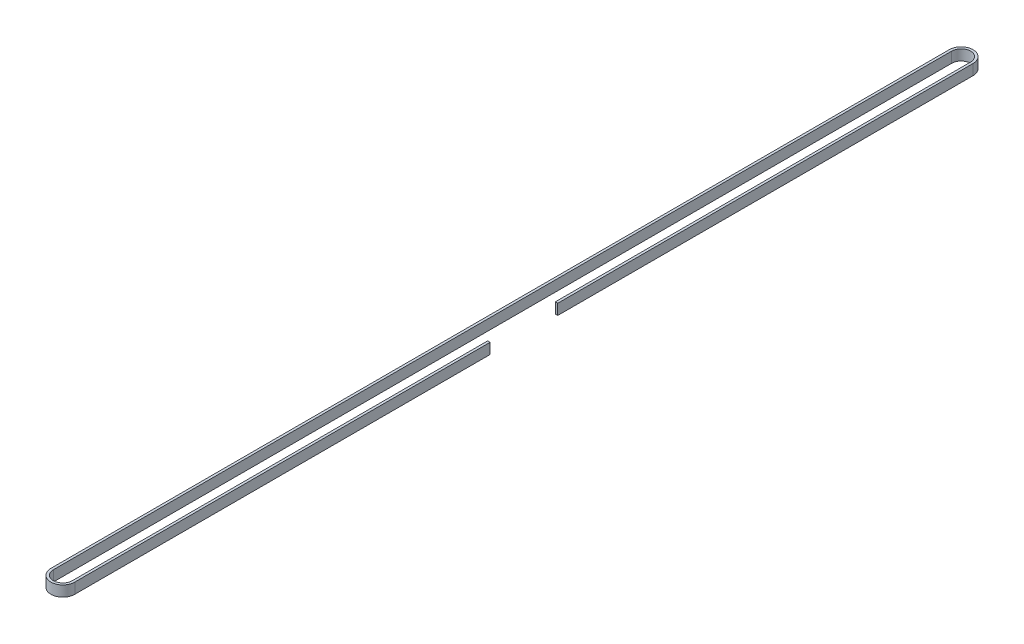
from build123d import *

# Parameters (mm, degrees)
EXTRUDE_THIN1_DEPTH = 6


with BuildPart() as part:
    # Sketch1 → Extrude-Thin1 (new body)
    with BuildSketch(Plane(origin=(0, 0, 0), x_dir=(1, 0, 0), z_dir=(0, 1, 0))):
        with BuildLine():
            Line((355.746, -59.767481844), (355.746, -294.767481844))
            ThreePointArc((355.746, -294.767481844), (350.38, -300.133481844), (345.014, -294.767481844))
            Line((345.014, -294.767481844), (345.014, 213.482518156))
            ThreePointArc((345.014, 213.482518156), (350.38, 218.848518156), (355.746, 213.482518156))
            Line((355.746, 213.482518156), (355.746, -21.517481844))
            Line((355.746, -21.517481844), (357.126, -21.517481844))
            Line((357.126, -21.517481844), (357.126, 213.482518156))
            ThreePointArc((357.126, 213.482518156), (350.38, 220.228518156), (343.634, 213.482518156))
            Line((343.634, 213.482518156), (343.634, -294.767481844))
            ThreePointArc((343.634, -294.767481844), (350.38, -301.513481844), (357.126, -294.767481844))
            Line((357.126, -294.767481844), (357.126, -59.767481844))
            Line((357.126, -59.767481844), (355.746, -59.767481844))
        make_face()
    extrude(amount=EXTRUDE_THIN1_DEPTH)


solid = part.part
